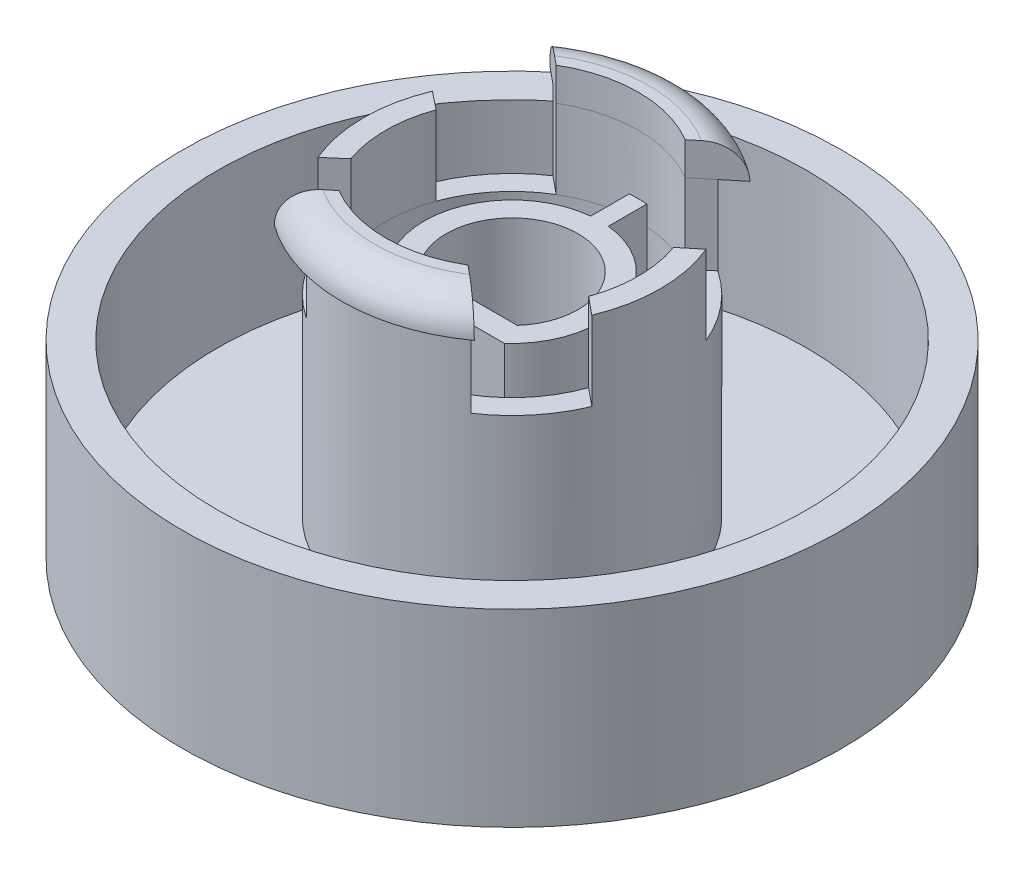
from build123d import *

# Parameters (mm, degrees)
SKETCH_1_R      = 15
EXTRUDE_1_DEPTH = 8.6
SHELL_1_T       = -1.6
SKETCH_2_R      = 6.75
SKETCH_2_R_2    = 5.75
EXTRUDE_2_DEPTH = 8.8
EXTRUDE_4_DEPTH = 3.6
EXTRUDE_7_DEPTH = 1.5
FILLET_2_R      = 1.5
EXTRUDE_8_DEPTH = 9.7


with BuildPart() as part:
    # 草图1 → 凸台-拉伸1 (new body)
    with BuildSketch(Plane(origin=(0, 0, 0), x_dir=(1, 0, 0), z_dir=(0, 1, 0))):
        with Locations(Location((0, 0, 0), (0, 0, 90))):
            Circle(SKETCH_1_R)
    extrude(amount=EXTRUDE_1_DEPTH)

    # 抽壳1
    shell_1_openings = [part.faces().sort_by_distance(p)[0] for p in [
        (0, 8.6, 0),
    ]]
    offset(amount=SHELL_1_T, openings=shell_1_openings, kind=Kind.INTERSECTION)

    # 草图2 → 凸台-拉伸2 (add)
    with BuildSketch(Plane(origin=(0, 1.6, 0), x_dir=(1, 0, 0), z_dir=(0, 1, 0))):
        with Locations(Location((0, 0, 0), (0, 0, 270))):
            Circle(SKETCH_2_R)
        with Locations(Location((0, 0, 0), (0, 0, 270))):
            Circle(SKETCH_2_R_2, mode=Mode.SUBTRACT)
    extrude(amount=EXTRUDE_2_DEPTH)

    # 草图5 → 凸台-拉伸4 (add)
    with BuildSketch(Plane(origin=(0, 10.4, 0), x_dir=(1, 0, 0), z_dir=(0, 1, 0))):
        with BuildLine():
            Line((-6.229165273, 2.6), (-5.407902558, 1.954279393))
            ThreePointArc((-5.407902558, 1.954279393), (-5.750152822, 0.018988088), (-5.420691276, -1.918521336))
            Line((-5.420691276, -1.918521336), (-6.224112, -2.612073854))
            ThreePointArc((-6.224112, -2.612073854), (-6.749996828, -0.006544339), (-6.229165273, 2.6))
        make_face()
        with BuildLine():
            Line((-3.75, 5.61248608), (-2.937259379, 4.943392091))
            ThreePointArc((-2.937259379, 4.943392091), (0, 5.750184173), (2.937259379, 4.943392091))
            Line((2.937259379, 4.943392091), (3.75, 5.61248608))
            ThreePointArc((3.75, 5.61248608), (0, 6.75), (-3.75, 5.61248608))
        make_face()
        with BuildLine():
            Line((6.229165273, 2.6), (5.416190763, 1.931190215))
            ThreePointArc((5.416190763, 1.931190215), (5.750184173, 0), (5.416190763, -1.931190215))
            Line((5.416190763, -1.931190215), (6.229165273, -2.6))
            ThreePointArc((6.229165273, -2.6), (6.75, 0), (6.229165273, 2.6))
        make_face()
        with BuildLine():
            Line((3.75, -5.61248608), (2.937259379, -4.943392091))
            ThreePointArc((2.937259379, -4.943392091), (0, -5.750184173), (-2.937259379, -4.943392091))
            Line((-2.937259379, -4.943392091), (-3.75, -5.61248608))
            ThreePointArc((-3.75, -5.61248608), (0, -6.75), (3.75, -5.61248608))
        make_face()
    extrude(amount=EXTRUDE_4_DEPTH)

    # 草图14 → 凸台-拉伸7 (add)
    with BuildSketch(Plane(origin=(0, 14, 0), x_dir=(1, 0, 0), z_dir=(0, 1, 0))):
        with BuildLine():
            Line((-4.551719875, 6.272507169), (-3.75, 5.61248608))
            Line((-3.75, 5.61248608), (-2.937108239, 4.943267664))
            ThreePointArc((-2.937108239, 4.943267664), (-0.000121801, 5.749999999), (2.936898812, 4.943392091))
            Line((2.936898812, 4.943392091), (3.75, 5.61248608))
            Line((3.75, 5.61248608), (4.551908877, 6.272370013))
            ThreePointArc((4.551908877, 6.272370013), (0.000116762, 7.749999999), (-4.551719875, 6.272507169))
        make_face()
        with BuildLine():
            Line((4.551908877, -6.272370013), (3.75, -5.61248608))
            Line((3.75, -5.61248608), (2.936898812, -4.943392091))
            ThreePointArc((2.936898812, -4.943392091), (-0.000121801, -5.749999999), (-2.937108239, -4.943267664))
            Line((-2.937108239, -4.943267664), (-3.75, -5.61248608))
            Line((-3.75, -5.61248608), (-4.551719875, -6.272507169))
            ThreePointArc((-4.551719875, -6.272507169), (0.000116762, -7.749999999), (4.551908877, -6.272370013))
        make_face()
    extrude(amount=EXTRUDE_7_DEPTH)

    # 圆角2
    fillet_2_edges = [part.edges().sort_by_distance(p)[0] for p in [
        (0.000116762, 15.5, 7.749999999),
        (0.000116762, 15.5, -7.749999999),
    ]]
    fillet(fillet_2_edges, radius=FILLET_2_R - 0.0001)  # a hair under: the kernel refuses the full size

    # 草图15 → 凸台-拉伸8 (add)
    with BuildSketch(Plane(origin=(0, 1.6, 0), x_dir=(1, 0, 0), z_dir=(0, 1, 0))):
        with BuildLine():
            Line((-2.645751311, -3), (-0.4, -3))
            Line((-0.4, -3), (-0.4, -5.736070083))
            ThreePointArc((-0.4, -5.736070083), (0, -5.75), (0.4, -5.736070083))
            Line((0.4, -5.736070083), (0.4, -3))
            Line((0.4, -3), (2.645751311, -3))
            ThreePointArc((2.645751311, -3), (3.807765077, 1.22512249), (0.4, 3.979949748))
            Line((0.4, 3.979949748), (0.4, 5.736070083))
            ThreePointArc((0.4, 5.736070083), (0, 5.75), (-0.4, 5.736070083))
            Line((-0.4, 5.736070083), (-0.4, 3.979949748))
            ThreePointArc((-0.4, 3.979949748), (-3.807765077, 1.22512249), (-2.645751311, -3))
        make_face()
        with BuildLine():
            Line((1.407515289, -2), (0.4, -2))
            Line((0.4, -2), (-0.4, -2))
            Line((-0.4, -2), (-2.236067977, -2))
            ThreePointArc((-2.236067977, -2), (0, 3), (2.236067977, -2))
            Line((2.236067977, -2), (1.407515289, -2))
        make_face(mode=Mode.SUBTRACT)
    extrude(amount=EXTRUDE_8_DEPTH)


solid = part.part
